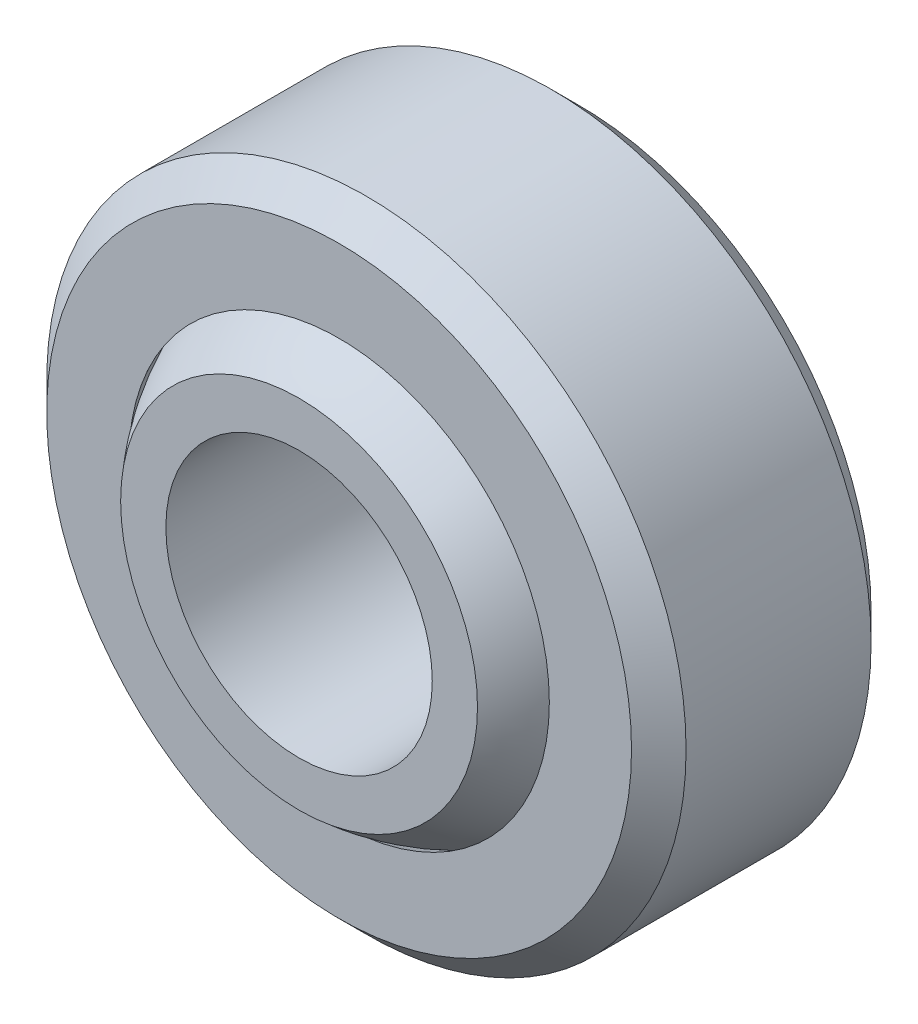
from build123d import *

# Parameters (mm, degrees)
SKETCH1_R               = 9.525
EXTRUDE1_DEPTH          = 3.5687
CUT_EXTRUDE1_DEPTH      = 16.278012717
CUT_EXTRUDE1_DEPTH_BACK = 16.278012717
SKETCH4_R               = 3.96875
CUT_EXTRUDE2_DEPTH      = 16.278012717
CUT_EXTRUDE2_DEPTH_BACK = 16.278012717
SKETCH5_W               = 1.169742594
SKETCH5_H               = 19.05
CHAMFER1_SIZE           = 0.8128


with BuildPart() as part:
    # Sketch1 → Extrude1 (new, symmetric)
    with BuildSketch(Plane.XY):
        Circle(SKETCH1_R)
    extrude(amount=EXTRUDE1_DEPTH, both=True)

    # Sketch2 → Cut-Revolve1 (revolve, cut)
    with BuildSketch(Plane.XY):
        with BuildLine():
            Line((0, 7.208774), (0, -7.208774))
            ThreePointArc((0, -7.208774), (7.208774, 0), (0, 7.208774))
        make_face()
    revolve(axis=Axis((0, 7.208774, 0), (0, 1, 0)), mode=Mode.SUBTRACT)

    # Chamfer1
    chamfer1_edges = [part.edges().sort_by_distance(p)[0] for p in [
        (-9.525, 0, 3.5687),
        (-9.525, 0, -3.5687),
    ]]
    chamfer(chamfer1_edges, length=CHAMFER1_SIZE)


with BuildPart() as body_2:
    # Sketch3 → Revolve1 (revolve)
    with BuildSketch(Plane.XY):
        with BuildLine():
            Line((0, 7.1374), (0, -7.1374))
            ThreePointArc((0, -7.1374), (7.1374, 0), (0, 7.1374))
        make_face()
    revolve(axis=Axis((0, 7.1374, 0), (0, 1, 0)))

    # Sketch4 → Cut-Extrude1 (cut, two sides: drawn at the far end of the back side and taken through both)
    with BuildSketch(Plane.XY.offset(-CUT_EXTRUDE1_DEPTH_BACK)):
        Circle(SKETCH4_R)
    extrude(amount=CUT_EXTRUDE1_DEPTH + CUT_EXTRUDE1_DEPTH_BACK, mode=Mode.SUBTRACT)

    # Sketch5 → Cut-Extrude2 (cut, two sides: drawn at the far end of the back side and taken through both)
    with BuildSketch(Plane(origin=(0, 0, 0), x_dir=(0, 0, -1), z_dir=(1, 0, 0)).offset(-CUT_EXTRUDE2_DEPTH_BACK)):
        with Locations((-5.347371297, 0)):
            Rectangle(SKETCH5_W, SKETCH5_H)
        with Locations((5.347371297, 0)):
            Rectangle(SKETCH5_W, SKETCH5_H)
    extrude(amount=CUT_EXTRUDE2_DEPTH + CUT_EXTRUDE2_DEPTH_BACK, mode=Mode.SUBTRACT)


solid = Compound([part.part, body_2.part])
